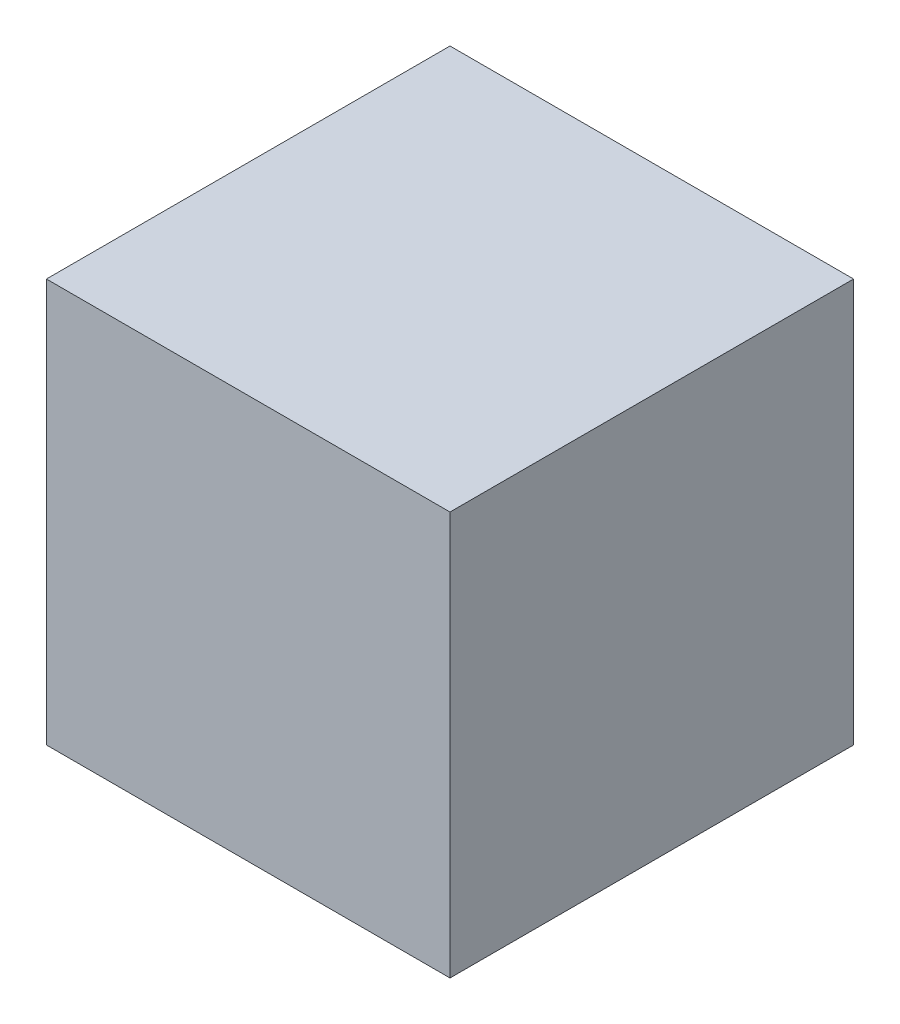
from build123d import *

# Parameters (mm, degrees)
SKETCH1_W           = 203.2
SKETCH1_H           = 203.2
BOSS_EXTRUDE1_DEPTH = 203.2
SKETCH2_W           = 93
SKETCH2_H           = 78
BOSS_EXTRUDE2_DEPTH = 20.32


with BuildPart() as part:
    # Sketch1 → Boss-Extrude1 (new body)
    with BuildSketch(Plane(origin=(0, 0, 0), x_dir=(1, 0, 0), z_dir=(0, 1, 0))):
        Rectangle(SKETCH1_W, SKETCH1_H)
    extrude(amount=BOSS_EXTRUDE1_DEPTH)


with BuildPart() as body_2:
    # Sketch2 → Boss-Extrude2 (new body)
    with BuildSketch(Plane(origin=(0, 0, 0), x_dir=(1, 0, 0), z_dir=(0, 1, 0))):
        Rectangle(SKETCH2_W, SKETCH2_H)
    extrude(amount=BOSS_EXTRUDE2_DEPTH)


solid = Compound([part.part, body_2.part])
